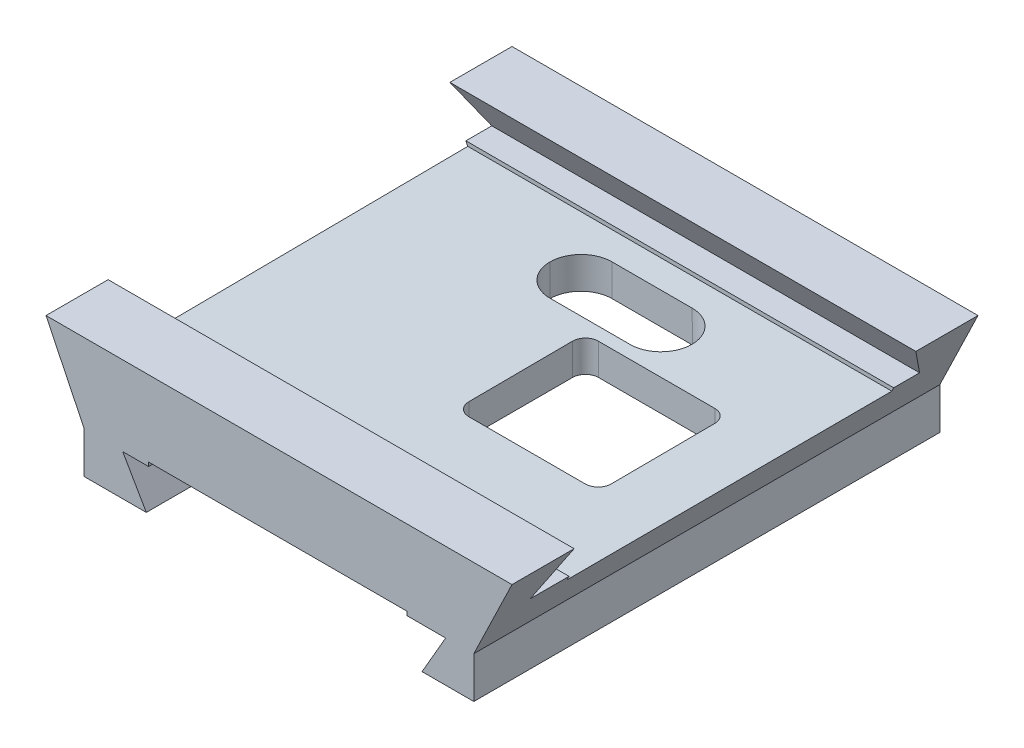
from build123d import *

# Parameters (mm, degrees)
BOSS_EXTRUDE1_DEPTH = 180
CUT_EXTRUDE1_DEPTH  = 207.548420473
BOSS_EXTRUDE2_DEPTH = 175
CUT_EXTRUDE5_DEPTH  = 180
CUT_EXTRUDE6_DEPTH  = 180
SKETCH7_W           = 55
SKETCH7_H           = 24
CUT_EXTRUDE7_DEPTH  = 180
SKETCH8_W           = 55
SKETCH8_H           = 50
CUT_EXTRUDE8_DEPTH  = 180
FILLET1_R           = 12
FILLET2_R           = 12
FILLET3_R           = 12
FILLET4_R           = 12
FILLET5_R           = 5
FILLET6_R           = 5
FILLET7_R           = 5
FILLET8_R           = 5


with BuildPart() as part:
    # Sketch1 → Boss-Extrude1 (new body)
    with BuildSketch(Plane.XY):
        Polygon((-75.25, 0), (75.25, 0), (75.25, 16), (90, 46.5), (-90, 46.5), (-75.25, 16), align=None)
    extrude(amount=BOSS_EXTRUDE1_DEPTH)

    # Sketch2 → Cut-Extrude1 (cut, through all)
    with BuildSketch(Plane.XY.offset(180)):
        Polygon((-51.25, 0), (-60.372134253, 15.8), (-50.372134253, 15.8), (-50.372134253, 17.3), (49.372134253, 17.3), (49.372134253, 15.8), (64.372134253, 15.8), (55.25, 0), align=None)
    extrude(amount=-CUT_EXTRUDE1_DEPTH, mode=Mode.SUBTRACT)


with BuildPart() as body_2:
    # Sketch3 → Boss-Extrude2 (new body)
    with BuildSketch(Plane.XY.offset(180)):
        Polygon((90, 46.5), (75.25, 16), (90, 16), align=None)
    extrude(amount=-BOSS_EXTRUDE2_DEPTH)


with BuildPart() as cut_extrude5_tool:
    # Sketch5 → Cut-Extrude5 (new body)
    with BuildSketch(Plane(origin=(90, 0, 0), x_dir=(0, 0, -1), z_dir=(1, 0, 0))):
        Polygon((-156, 46.5), (-165.237604307, 30.5), (-150.237604307, 30.5), (-150.237604307, 29), (-25.18556724, 29.732954619), (-25.18556724, 31.232954619), (-15.18556724, 31.232954619), (-24, 46.5), align=None)
    extrude(amount=-CUT_EXTRUDE5_DEPTH)


with BuildPart() as part_1:
    add(part.part)

    # Cut-Extrude5: cut by cut_extrude5_tool
    add(cut_extrude5_tool.part, mode=Mode.SUBTRACT)

    # Sketch7 → Cut-Extrude7 (cut)
    with BuildSketch(Plane(origin=(0, 29.879545719, 0.175129902), x_dir=(1, 0, 0), z_dir=(0, 0.9999828236276607, 0.005861096284045548))):
        with Locations((0, -47.727459023)):
            Rectangle(SKETCH7_W, SKETCH7_H)
    extrude(amount=-CUT_EXTRUDE7_DEPTH, mode=Mode.SUBTRACT)

    # Sketch8 → Cut-Extrude8 (cut)
    with BuildSketch(Plane(origin=(0, 29.879545719, 0.175129902), x_dir=(1, 0, 0), z_dir=(0, 0.9999828236276607, 0.005861096284045548))):
        with Locations((30.72704543, -89.724367276)):
            Rectangle(SKETCH8_W, SKETCH8_H)
    extrude(amount=-CUT_EXTRUDE8_DEPTH, mode=Mode.SUBTRACT)

    # Fillet1
    fillet1_edges = [part_1.edges().sort_by_distance(p)[0] for p in [
        (-27.5, 23.414738665, 59.865723337),
    ]]
    fillet(fillet1_edges, radius=FILLET1_R)

    # Fillet2
    fillet2_edges = [part_1.edges().sort_by_distance(p)[0] for p in [
        (-27.5, 23.485071821, 35.865723333),
    ]]
    fillet(fillet2_edges, radius=FILLET2_R - 0.0001)  # a hair under: the kernel refuses the full size

    # Fillet3
    fillet3_edges = [part_1.edges().sort_by_distance(p)[0] for p in [
        (27.5, 23.414738665, 59.865723337),
    ]]
    fillet(fillet3_edges, radius=FILLET3_R)

    # Fillet4
    fillet4_edges = [part_1.edges().sort_by_distance(p)[0] for p in [
        (27.5, 23.485071821, 35.865723333),
    ]]
    fillet(fillet4_edges, radius=FILLET4_R - 0.0001)  # a hair under: the kernel refuses the full size

    # Fillet5
    fillet5_edges = [part_1.edges().sort_by_distance(p)[0] for p in [
        (58.22704543, 22.650094985, 64.858235693),
    ]]
    fillet(fillet5_edges, radius=FILLET5_R)

    # Fillet6
    fillet6_edges = [part_1.edges().sort_by_distance(p)[0] for p in [
        (3.22704543, 23.400094985, 64.86263159),
    ]]
    fillet(fillet6_edges, radius=FILLET6_R)

    # Fillet7
    fillet7_edges = [part_1.edges().sort_by_distance(p)[0] for p in [
        (3.22704543, 23.253567578, 114.862631598),
    ]]
    fillet(fillet7_edges, radius=FILLET7_R)

    # Fillet8
    fillet8_edges = [part_1.edges().sort_by_distance(p)[0] for p in [
        (58.22704543, 22.503567578, 114.8582357),
    ]]
    fillet(fillet8_edges, radius=FILLET8_R)


with BuildPart() as body_2_1:
    add(body_2.part)

    # Cut-Extrude5: cut by cut_extrude5_tool
    add(cut_extrude5_tool.part, mode=Mode.SUBTRACT)

    # Sketch6 → Cut-Extrude6 (cut)
    with BuildSketch(Plane.XY.offset(180)):
        Polygon((75.25, 16), (90, 46.5), (90, 16), align=None)
    extrude(amount=-CUT_EXTRUDE6_DEPTH, mode=Mode.SUBTRACT)


solid = part_1.part
